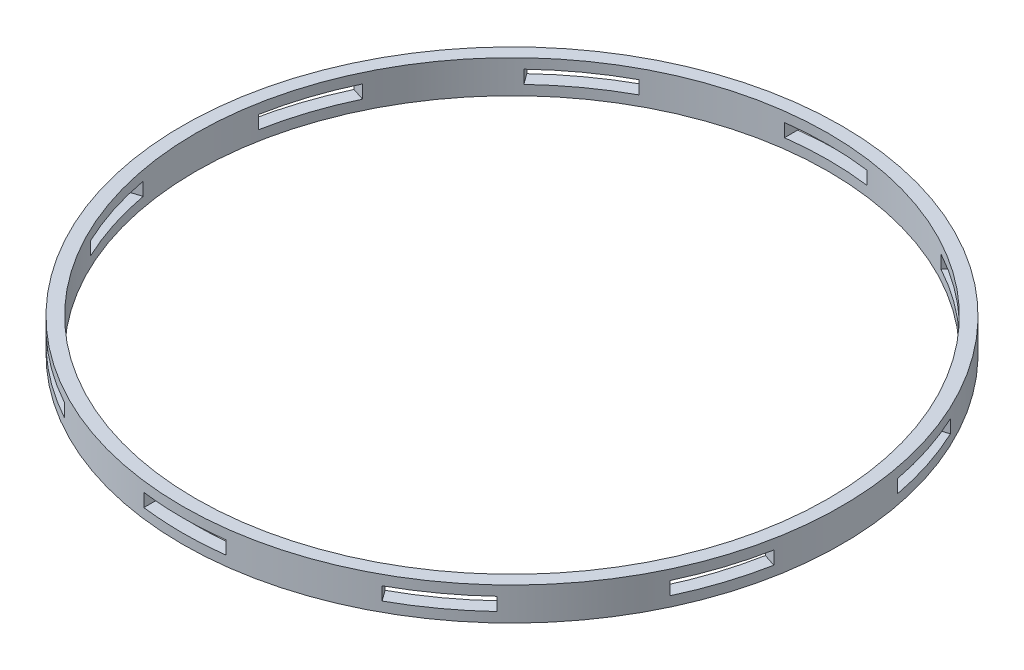
from build123d import *

# Parameters (mm, degrees)
SKETCH1_R           = 100
SKETCH1_R_2         = 96
BOSS_EXTRUDE1_DEPTH = 10
SKETCH2_W           = 25
SKETCH2_H           = 4
CUT_EXTRUDE1_DEPTH  = 142.774468788
CIRPATTERN1_COUNT   = 10


with BuildPart() as part:
    # Sketch1 → Boss-Extrude1 (new body)
    with BuildSketch(Plane(origin=(0, 0, 0), x_dir=(1, 0, 0), z_dir=(0, 1, 0))):
        Circle(SKETCH1_R)
        Circle(SKETCH1_R_2, mode=Mode.SUBTRACT)
    extrude(amount=BOSS_EXTRUDE1_DEPTH)

    # Sketch2 → Cut-Extrude1 (cut, through all)
    with BuildSketch(Plane.XY):
        with Locations((0, 5)):
            Rectangle(SKETCH2_W, SKETCH2_H)
    cut_extrude1 = extrude(amount=-CUT_EXTRUDE1_DEPTH, mode=Mode.SUBTRACT)

    # CirPattern1: Cut-Extrude1 ×10 about axis
    cirpattern1_axis = Axis((0, 10, 0), (0, -1, 0))
    for i in range(1, CIRPATTERN1_COUNT):
        add(cut_extrude1.rotate(cirpattern1_axis, i * 360 / CIRPATTERN1_COUNT), mode=Mode.SUBTRACT)


solid = part.part
